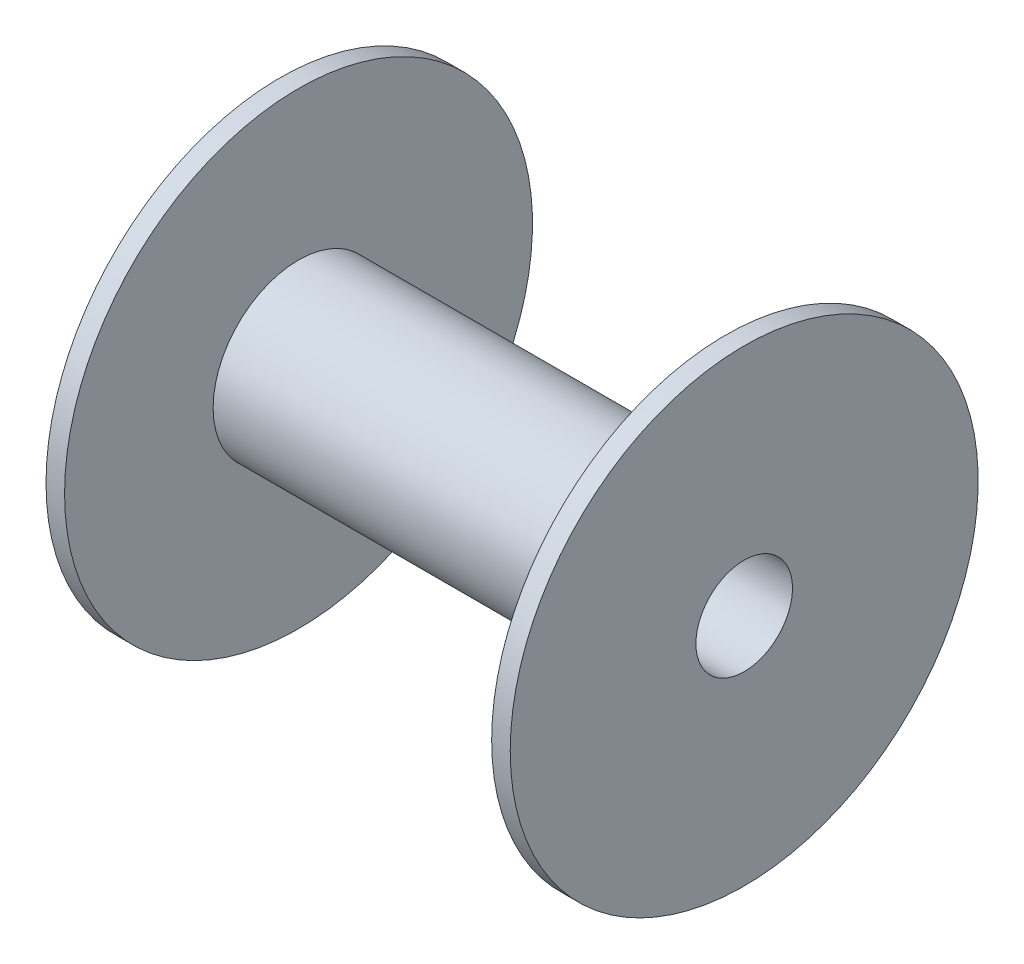
from build123d import *


with BuildPart() as part:
    # Sketch1 → Revolve1 (revolve)
    with BuildSketch(Plane.XY):
        Polygon((-62.5, 63), (-57.5, 63), (-57.5, 23), (57.5, 23), (57.5, 63), (62.5, 63), (62.5, 13), (-62.5, 13), align=None)
    revolve(axis=Axis((-75, 0, 0), (1, 0, 0)))


solid = part.part
